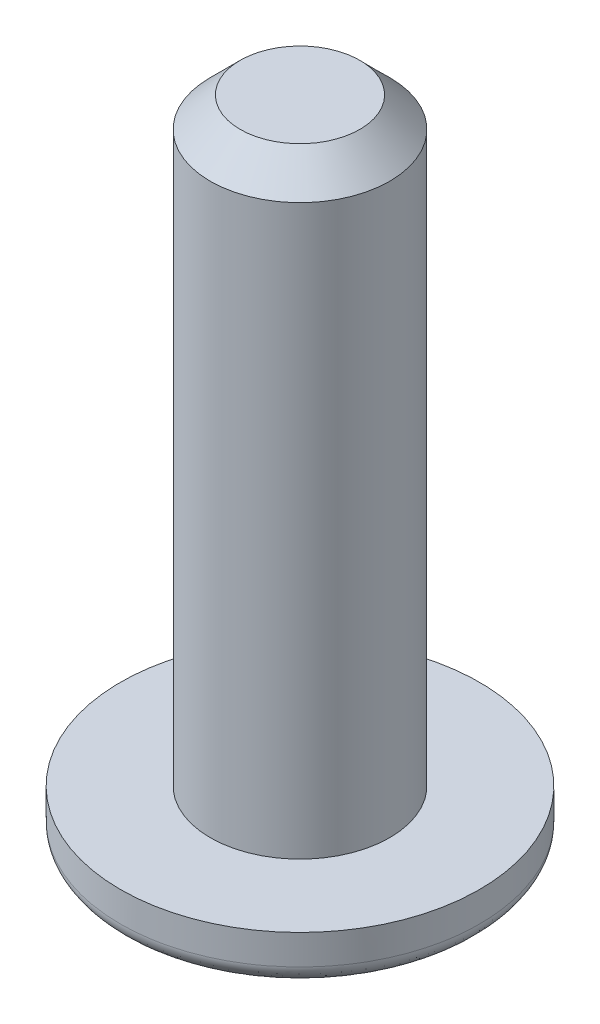
from build123d import *

# Parameters (mm, degrees)
SKETCH_1_R          = 3
EXTRUDE_1_DEPTH     = 1
SKETCH_2_R          = 1.5
EXTRUDE_2_DEPTH     = 10
CUT_EXTRUDE_1_DEPTH = 1
FILLET_1_SIZE       = 0.5
FILLET_1_SIZE_2     = 1
CHAMFER_1_SIZE      = 0.5


with BuildPart() as part:
    # 草图1 → 凸台-拉伸1 (new body)
    with BuildSketch(Plane(origin=(0, 0, 0), x_dir=(1, 0, 0), z_dir=(0, 1, 0))):
        with Locations(Location((0, 0, 0), (0, 0, 270))):
            Circle(SKETCH_1_R)
    extrude(amount=EXTRUDE_1_DEPTH)

    # 草图2 → 凸台-拉伸2 (add)
    with BuildSketch(Plane(origin=(0, 1, 0), x_dir=(1, 0, 0), z_dir=(0, 1, 0))):
        with Locations(Location((0, 0, 0), (0, 0, 270))):
            Circle(SKETCH_2_R)
    extrude(amount=EXTRUDE_2_DEPTH)

    # 草图3 → 切除-拉伸1 (cut)
    with BuildSketch(Plane.XZ):
        Polygon((0, 1.154700538), (-1, 0.577350269), (-1, -0.577350269), (0, -1.154700538), (1, -0.577350269), (1, 0.577350269), align=None)
    extrude(amount=-CUT_EXTRUDE_1_DEPTH, mode=Mode.SUBTRACT)

    # 圆角1
    # an asymmetric fillet: 1, 0.5 mm, written as the material it takes off along each edge
    with BuildSketch(Plane(origin=(0, 0, 0), x_dir=(0, 0, 1), z_dir=(-1, 0, 0))) as fillet_1_piece_1:
        with BuildLine():
            Bezier((3, FILLET_1_SIZE), (3, 0), (3 - FILLET_1_SIZE_2, 0), weights=[1, 0.707106781, 1])
            Line((3 - FILLET_1_SIZE_2, 0), (3, 0))
            Line((3, 0), (3, FILLET_1_SIZE))
        make_face()
    revolve(axis=Axis((0, 0, 0), (0, 1, 0)), mode=Mode.SUBTRACT)

    # 倒角1
    chamfer_1_edges = [part.edges().sort_by_distance(p)[0] for p in [
        (0, 11, -1.5),
    ]]
    chamfer(chamfer_1_edges, length=CHAMFER_1_SIZE)


solid = part.part
